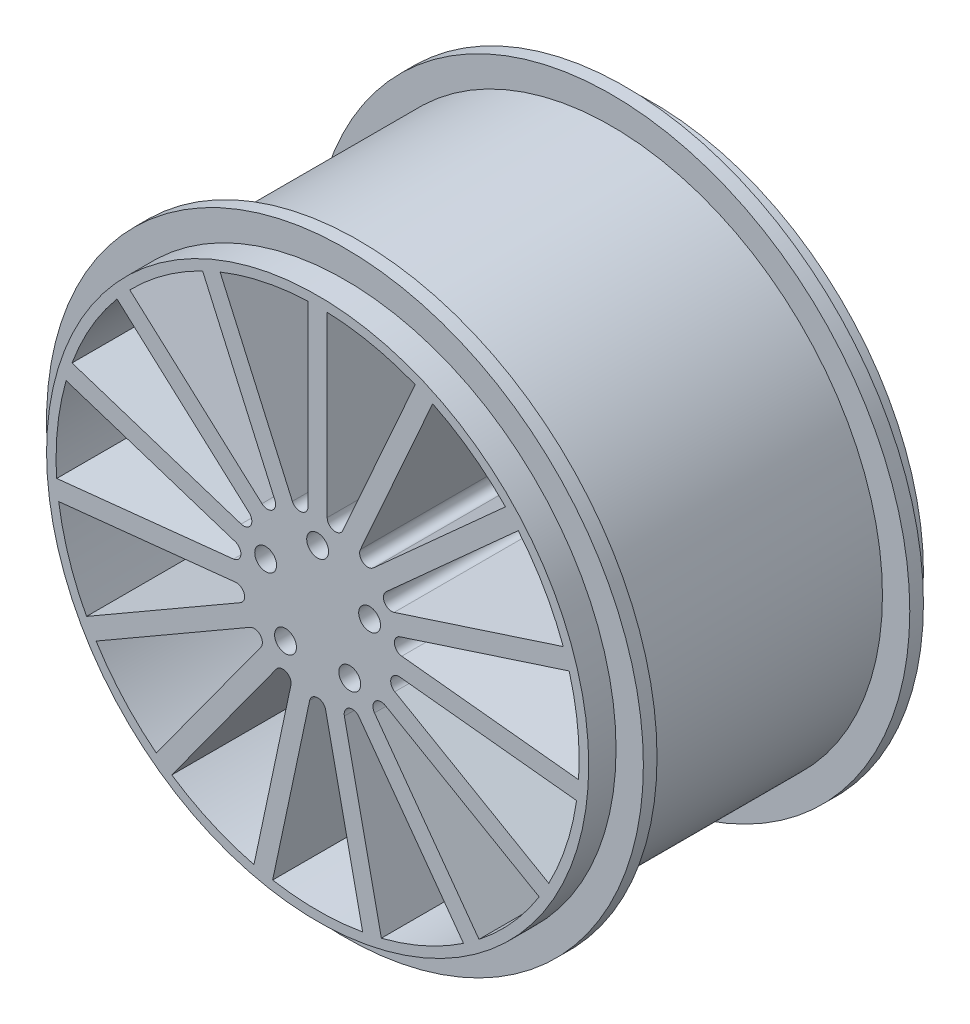
from build123d import *

# Parameters (mm, degrees)
ESTRUSIONE_ESTRUSIONE2_DEPTH = 165
RIPETIZIONECIRCOLARE1_COUNT  = 15
SCHIZZO6_R                   = 8
TAGLIO_ESTRUSIONE1_DEPTH     = 326.53027701
RIPETIZIONECIRCOLARE2_COUNT  = 5
ESTRUSIONE_ESTRUSIONE4_START = 80
SCHIZZO7_R                   = 198.425
SCHIZZO7_R_2                 = 191.425
ESTRUSIONE_ESTRUSIONE4_DEPTH = 80
SCHIZZO8_W                   = 10
SCHIZZO8_H                   = 20


with BuildPart() as part:
    # Schizzo1 → Estrusione-Estrusione2 (new body)
    with BuildSketch(Plane.XY):
        with BuildLine():
            Line((0, 0), (0, 198.425))
            ThreePointArc((0, 198.425), (41.254877251, 194.088937676), (80.706718402, 181.270257433))
            Line((80.706718402, 181.270257433), (0, 0))
        make_face()
        with BuildLine():
            Line((7, 61.160191423), (7, 191.296969722))
            ThreePointArc((7, 191.296969722), (39.799495415, 187.24190447), (71.412669092, 177.605634252))
            Line((71.412669092, 177.605634252), (18.481272746, 58.719771565))
            ThreePointArc((18.481272746, 58.719771565), (11.752529855, 55.291305819), (7, 61.160191423))
        make_face(mode=Mode.SUBTRACT)
    estrusione_estrusione2 = extrude(amount=ESTRUSIONE_ESTRUSIONE2_DEPTH)

    # RipetizioneCircolare1: Estrusione-Estrusione2 ×15 about axis
    ripetizionecircolare1_axis = Axis((0, 0, 165), (0, 0, -1))
    for i in range(1, RIPETIZIONECIRCOLARE1_COUNT):
        add(estrusione_estrusione2.rotate(ripetizionecircolare1_axis, i * 360 / RIPETIZIONECIRCOLARE1_COUNT))

    # Schizzo6 → Taglio-Estrusione1 (cut, through all)
    with BuildSketch(Plane.XY.offset(165)):
        with Locations((0, 40)):
            Circle(SCHIZZO6_R)
    taglio_estrusione1 = extrude(amount=-TAGLIO_ESTRUSIONE1_DEPTH, mode=Mode.SUBTRACT)

    # RipetizioneCircolare2: Taglio-Estrusione1 ×5 about axis
    ripetizionecircolare2_axis = Axis((0, 0, 165), (0, 0, 1))
    for i in range(1, RIPETIZIONECIRCOLARE2_COUNT):
        add(taglio_estrusione1.rotate(ripetizionecircolare2_axis, i * 360 / RIPETIZIONECIRCOLARE2_COUNT), mode=Mode.SUBTRACT)

    # Schizzo7 → Estrusione-Estrusione4 (add)
    with BuildSketch(Plane(origin=(0, 0, 0), x_dir=(-1, 0, 0), z_dir=(0, 0, -1)).offset(ESTRUSIONE_ESTRUSIONE4_START)):
        Circle(SCHIZZO7_R)
        Circle(SCHIZZO7_R_2, mode=Mode.SUBTRACT)
    extrude(amount=-ESTRUSIONE_ESTRUSIONE4_DEPTH)

    # Schizzo8 → Rivoluzione1 (revolve)
    with BuildSketch(Plane(origin=(0, 0, 0), x_dir=(0, 0, -1), z_dir=(1, 0, 0))):
        with Locations((-140, 208.425)):
            Rectangle(SCHIZZO8_W, SCHIZZO8_H)
        with Locations((55, 208.425)):
            Rectangle(SCHIZZO8_W, SCHIZZO8_H)
    revolve(axis=Axis((0, 0, 0), (0, 0, -1)))


solid = part.part
